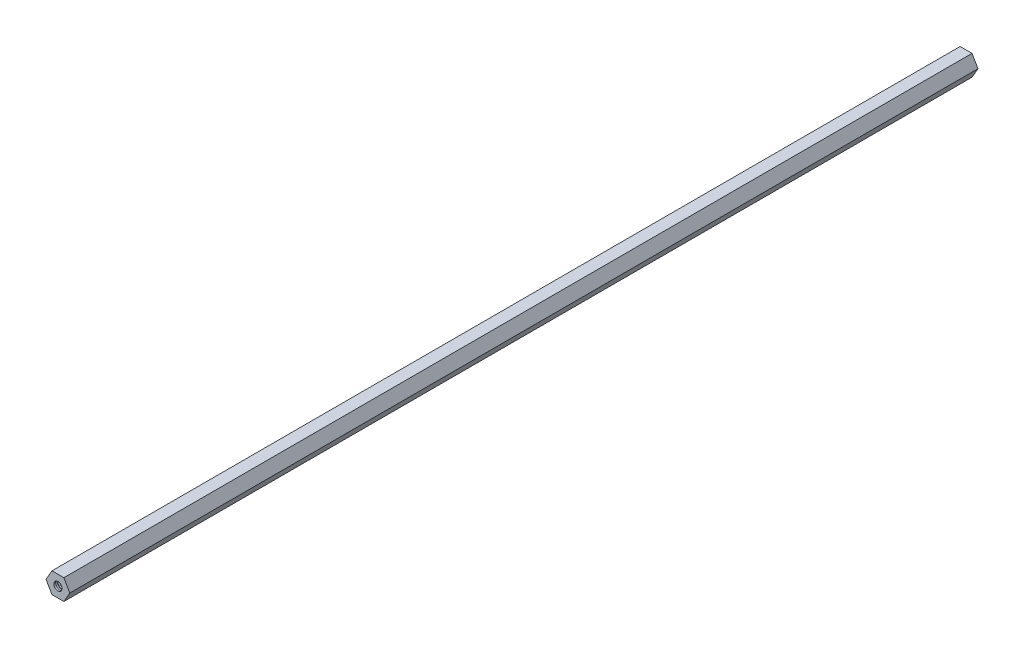
from build123d import *
from build123d.topology import SkipClean

# Parameters (mm, degrees)
EXTRUSI_N_HEX_PROFILE_DEPTH = 279.4
TAP_START                   = 279.4
CROQUIS3_R                  = 2.5527
TAP_HOLE_1_DEPTH            = 19.05
TAP_START_2                 = -260.35
CROQUIS3_3_R                = 2.5527
TAP_HOLE_2_DEPTH            = 19.05
ROSCA1_PITCH                = 1.27
ROSCA2_PITCH                = 1.27


with BuildPart() as part:
    # Croquis2 → Extrusión Hex Profile (new, symmetric)
    with BuildSketch(Plane.XY):
        Polygon((3.666174209, -6.35), (7.332348419, 0), (3.666174209, 6.35), (-3.666174209, 6.35), (-7.332348419, 0), (-3.666174209, -6.35), align=None)
    extrude(amount=EXTRUSI_N_HEX_PROFILE_DEPTH, both=True)

    # Croquis3 → Tap Hole 1 (cut)
    with BuildSketch(Plane.XY.offset(TAP_START)):
        Circle(CROQUIS3_R)
    extrude(amount=-TAP_HOLE_1_DEPTH, mode=Mode.SUBTRACT)

    # Croquis3<3> → Tap Hole 2 (cut)
    with BuildSketch(Plane.XY.offset(TAP_START_2)):
        Circle(CROQUIS3_3_R)
    extrude(amount=-TAP_HOLE_2_DEPTH, mode=Mode.SUBTRACT)

    # Rosca1: the profile of Perfil de rosca1 profile screwed along a right-hand helix of 15 turns, 8 arcs to a turn; built about Z, then put on its axis
    rosca1_z = Axis((0, 0, 0), (0, 0, 1))
    rosca1_corners = [(2.5524, 0, -0.000173205), (3.240107661, 0, 0.396874998), (3.240107661, 0, 0.555624998), (2.5524, 0, 0.952673202)]
    with BuildLine(mode=Mode.PRIVATE) as rosca1_profile:
        Line(rosca1_corners[0], rosca1_corners[1])
        Line(rosca1_corners[1], rosca1_corners[2])
        Line(rosca1_corners[2], rosca1_corners[3])
        Line(rosca1_corners[3], rosca1_corners[0])
    rosca1_cap = Face(rosca1_profile.wire())
    rosca1_turn_angles = [0, 22.5, 45, 67.5, 90, 112.5, 135, 157.5, 180, 202.5, 225, 247.5, 270, 292.5, 315, 337.5, 360]
    rosca1_turn_weights = [1, 0.9238795325112867, 1, 0.9238795325112867, 1, 0.9238795325112867, 1, 0.9238795325112867, 1, 0.9238795325112867, 1, 0.9238795325112867, 1, 0.9238795325112867, 1, 0.9238795325112867, 1]
    rosca1_turn_rails = [Edge.make_bspline([Vector(p[0], p[1], 0).rotate(rosca1_z, rosca1_turn_angles[k]) / rosca1_turn_weights[k] + Vector(0, 0, p[2] + ROSCA1_PITCH * rosca1_turn_angles[k] / 360) for k in range(17)], [0, 0, 0, 1, 1, 2, 2, 3, 3, 4, 4, 5, 5, 6, 6, 7, 7, 8, 8, 8], 2, rosca1_turn_weights) for p in rosca1_corners]
    rosca1_turn_sides = [Face.make_surface_from_curves(rosca1_turn_rails[p[0]], rosca1_turn_rails[p[1]]) for p in [(0, 1), (1, 2), (2, 3), (3, 0)]]
    rosca1 = Plane(origin=(0, 0, -279.4), x_dir=(1, 0, 0), z_dir=(0, 0, 1)) * Solid(Shell([*[p.moved(Location((0, 0, ROSCA1_PITCH * i))) for i in range(15) for p in rosca1_turn_sides], rosca1_cap, rosca1_cap.rotate(rosca1_z, 5400).moved(Location((0, 0, ROSCA1_PITCH * 5400 / 360)))]))
    add(rosca1, mode=Mode.SUBTRACT)

    # Rosca2: the profile of Perfil de rosca2 profile screwed along a right-hand helix of 15 turns, 8 arcs to a turn; built about Z, then put on its axis
    with SkipClean():  # the faces are left unmerged after this step: merging them gives an invalid solid
        rosca2_z = Axis((0, 0, 0), (0, 0, 1))
        rosca2_corners = [(2.5524, 0, -0.000173205), (3.240107661, 0, 0.396874998), (3.240107661, 0, 0.555624998), (2.5524, 0, 0.952673202)]
        with BuildLine(mode=Mode.PRIVATE) as rosca2_profile:
            Line(rosca2_corners[0], rosca2_corners[1])
            Line(rosca2_corners[1], rosca2_corners[2])
            Line(rosca2_corners[2], rosca2_corners[3])
            Line(rosca2_corners[3], rosca2_corners[0])
        rosca2_cap = Face(rosca2_profile.wire())
        rosca2_turn_angles = [0, 22.5, 45, 67.5, 90, 112.5, 135, 157.5, 180, 202.5, 225, 247.5, 270, 292.5, 315, 337.5, 360]
        rosca2_turn_weights = [1, 0.9238795325112867, 1, 0.9238795325112867, 1, 0.9238795325112867, 1, 0.9238795325112867, 1, 0.9238795325112867, 1, 0.9238795325112867, 1, 0.9238795325112867, 1, 0.9238795325112867, 1]
        rosca2_turn_rails = [Edge.make_bspline([Vector(p[0], p[1], 0).rotate(rosca2_z, rosca2_turn_angles[k]) / rosca2_turn_weights[k] + Vector(0, 0, p[2] + ROSCA2_PITCH * rosca2_turn_angles[k] / 360) for k in range(17)], [0, 0, 0, 1, 1, 2, 2, 3, 3, 4, 4, 5, 5, 6, 6, 7, 7, 8, 8, 8], 2, rosca2_turn_weights) for p in rosca2_corners]
        rosca2_turn_sides = [Face.make_surface_from_curves(rosca2_turn_rails[p[0]], rosca2_turn_rails[p[1]]) for p in [(0, 1), (1, 2), (2, 3), (3, 0)]]
        rosca2 = Plane(origin=(0, 0, 279.4), x_dir=(-1, 0, 0), z_dir=(0, 0, -1)) * Solid(Shell([*[p.moved(Location((0, 0, ROSCA2_PITCH * i))) for i in range(15) for p in rosca2_turn_sides], rosca2_cap, rosca2_cap.rotate(rosca2_z, 5400).moved(Location((0, 0, ROSCA2_PITCH * 5400 / 360)))]))
        add(rosca2, mode=Mode.SUBTRACT)


solid = part.part
